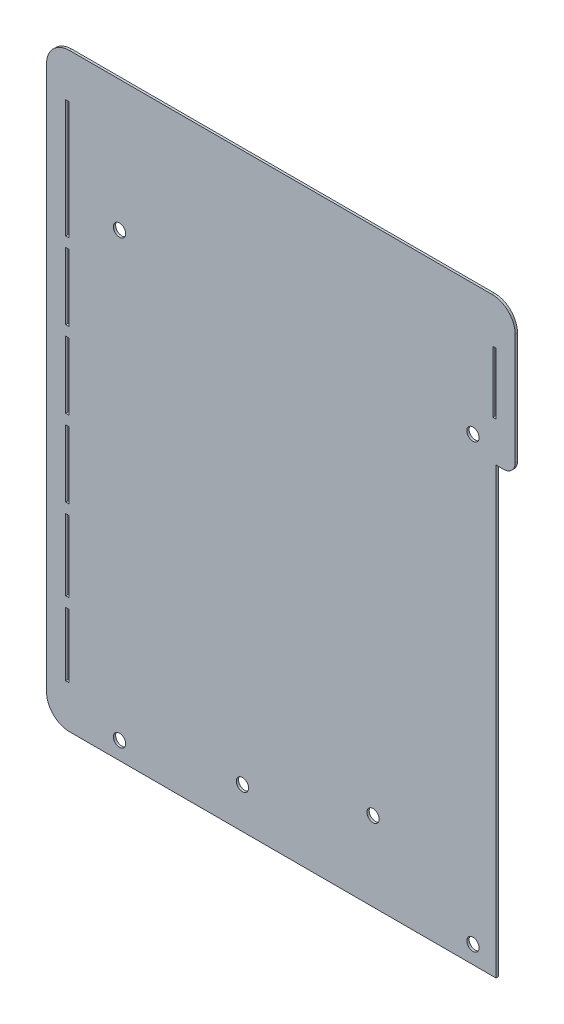
from build123d import *

# Parameters (mm, degrees)
BOSS_EXTRUDE1_DEPTH = 0.6
SKETCH14_R          = 1.6
SKETCH14_W          = 0.8
SKETCH14_H          = 30.7
SKETCH14_H_2        = 16.55
SKETCH14_H_3        = 17.4
SKETCH14_H_4        = 18.55
SKETCH14_H_5        = 16
CUT_EXTRUDE1_DEPTH  = 216.986998667
FILLET3_R           = 6
FILLET4_R           = 3
SKETCH15_R          = 1.6
CUT_EXTRUDE2_DEPTH  = 216.986998667


with BuildPart() as part:
    # Sketch2 → Boss-Extrude1 (new body)
    with BuildSketch(Plane.XY):
        Polygon((106.16728925, 147.241288665), (106.16728925, 31.58105), (24.16705825, 31.58105), (-10.832812, 31.58105), (-10.832812, 185.1806075), (24.16705825, 185.1806075), (106.16728925, 185.1806075), (111.16728925, 185.1806075), (111.16728925, 147.241288665), align=None)
    extrude(amount=BOSS_EXTRUDE1_DEPTH)

    # Sketch14 → Cut-Extrude1 (cut, through all)
    with BuildSketch(Plane.XY.offset(0.6)):
        with Locations((100.166839875, 36.181495)):
            Circle(SKETCH14_R)
        with Locations((8.167632375, 36.181495)):
            Circle(SKETCH14_R)
        with Locations((8.167632375, 151.18016)):
            Circle(SKETCH14_R)
        with Locations((100.166839875, 151.18016)):
            Circle(SKETCH14_R)
        with Locations((-5.432812, 158.23105)):
            Rectangle(SKETCH14_W, SKETCH14_H)
        with Locations((-5.432812, 50.85605)):
            Rectangle(SKETCH14_W, SKETCH14_H_2)
        with Locations((-5.432812, 131.58105)):
            Rectangle(SKETCH14_W, SKETCH14_H_3)
        with Locations((-5.432812, 71.00605)):
            Rectangle(SKETCH14_W, SKETCH14_H_4)
        with Locations((-5.432812, 91.58105)):
            Rectangle(SKETCH14_W, SKETCH14_H_3)
        with Locations((-5.432812, 111.58105)):
            Rectangle(SKETCH14_W, SKETCH14_H_3)
        with Locations((105.76728925, 165.58105)):
            Rectangle(SKETCH14_W, SKETCH14_H_5)
    extrude(amount=-CUT_EXTRUDE1_DEPTH, mode=Mode.SUBTRACT)

    # Fillet3
    fillet3_edges = [part.edges().sort_by_distance(p)[0] for p in [
        (-10.832812, 185.1806075, 0.3),
        (-10.832812, 31.58105, 0.3),
        (111.16728925, 185.1806075, 0.3),
    ]]
    fillet(fillet3_edges, radius=FILLET3_R)

    # Fillet4
    fillet4_edges = [part.edges().sort_by_distance(p)[0] for p in [
        (111.16728925, 147.241288665, 0.3),
    ]]
    fillet(fillet4_edges, radius=FILLET4_R)

    # Sketch15 → Cut-Extrude2 (cut, through all)
    with BuildSketch(Plane.XY.offset(0.6)):
        with Locations((74.166839875, 52.181495)):
            Circle(SKETCH15_R)
        with Locations((40.166839875, 42.181495)):
            Circle(SKETCH15_R)
    extrude(amount=-CUT_EXTRUDE2_DEPTH, mode=Mode.SUBTRACT)


solid = part.part
